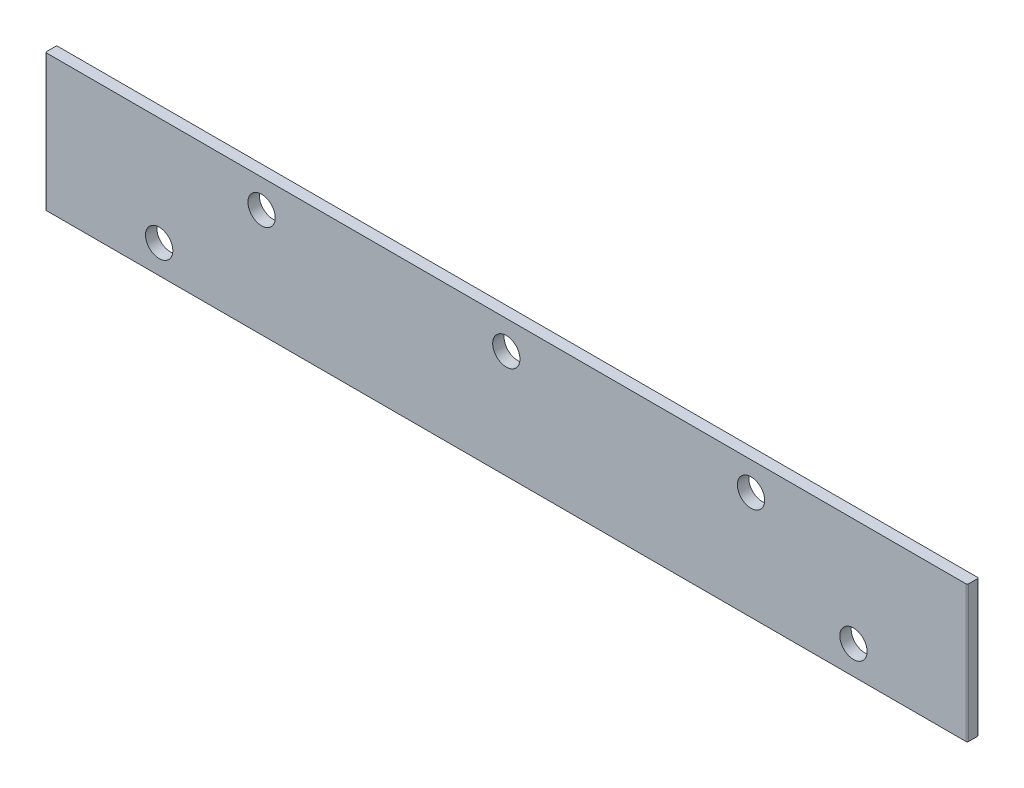
from build123d import *

# Parameters (mm, degrees)
SKETCH1_W           = 81
SKETCH1_H           = 12
BOSS_EXTRUDE1_DEPTH = 0.5
M2_HOLE1_AD_D       = 2.4
M2_HOLE1_AD_DEPTH   = 100
M2_HOLE1_AD_TIP     = 0.721032743
M2_HOLE2_AD_D       = 2.4
M2_HOLE2_AD_DEPTH   = 100
M2_HOLE2_AD_TIP     = 0.721032743
M2_HOLE3_AE_D       = 2.4
M2_HOLE3_AE_DEPTH   = 200
M2_HOLE3_AE_TIP     = 0.721032743
FILLET1_R           = 0.1


with BuildPart() as part:
    # Sketch1 → Boss-Extrude1 (new, symmetric)
    with BuildSketch(Plane.XY):
        Rectangle(SKETCH1_W, SKETCH1_H)
    extrude(amount=BOSS_EXTRUDE1_DEPTH, both=True)

    # M2 Hole1 - AD
    with Locations(Plane.XY.offset(0.5)):
        with Locations((-30.5, -3.5), (30.5, -3.5)):
            Hole(M2_HOLE1_AD_D / 2, depth=M2_HOLE1_AD_DEPTH)
            with Locations((0, 0, -(M2_HOLE1_AD_DEPTH + M2_HOLE1_AD_TIP / 2))):  # 118° drill point
                Cone(0, M2_HOLE1_AD_D / 2, M2_HOLE1_AD_TIP, mode=Mode.SUBTRACT)

    # M2 Hole2 - AD
    with Locations(Plane.XY.offset(0.5)):
        with Locations((-21.5, 3.5), (21.5, 3.5)):
            Hole(M2_HOLE2_AD_D / 2, depth=M2_HOLE2_AD_DEPTH)
            with Locations((0, 0, -(M2_HOLE2_AD_DEPTH + M2_HOLE2_AD_TIP / 2))):  # 118° drill point
                Cone(0, M2_HOLE2_AD_D / 2, M2_HOLE2_AD_TIP, mode=Mode.SUBTRACT)

    # M2 Hole3 - AE
    with Locations(Plane.XY.offset(0.5)):
        with Locations((0, 3.5)):
            Hole(M2_HOLE3_AE_D / 2, depth=M2_HOLE3_AE_DEPTH)
            with Locations((0, 0, -(M2_HOLE3_AE_DEPTH + M2_HOLE3_AE_TIP / 2))):  # 118° drill point
                Cone(0, M2_HOLE3_AE_D / 2, M2_HOLE3_AE_TIP, mode=Mode.SUBTRACT)

    # Fillet1
    fillet1_edges = [part.edges().sort_by_distance(p)[0] for p in [
        (40.5, 0, -0.5),
        (40.5, 0, 0.5),
        (-40.5, 0, -0.5),
        (-40.5, 0, 0.5),
    ]]
    fillet(fillet1_edges, radius=FILLET1_R)


solid = part.part
